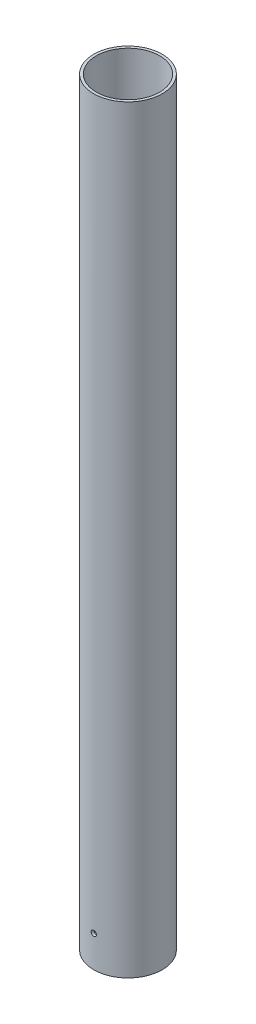
from build123d import *

# Parameters (mm, degrees)
SKETCH1_R               = 41.275
SKETCH1_R_2             = 38.1
BOSS_EXTRUDE1_DEPTH     = 914.4
CUT_EXTRUDE1_DEPTH      = 917.261213438
CUT_EXTRUDE1_DEPTH_BACK = 917.261213438
SKETCH2_R               = 3.175


with BuildPart() as part:
    # Sketch1 → Boss-Extrude1 (new body)
    with BuildSketch(Plane(origin=(0, 0, 0), x_dir=(1, 0, 0), z_dir=(0, 1, 0))):
        Circle(SKETCH1_R)
        Circle(SKETCH1_R_2, mode=Mode.SUBTRACT)
    extrude(amount=BOSS_EXTRUDE1_DEPTH)

    # Sketch2 → Cut-Extrude1 (cut, two sides: drawn at the far end of the back side and taken through both)
    with BuildSketch(Plane.XY.offset(-CUT_EXTRUDE1_DEPTH_BACK)):
        with Locations((0, 38.1)):
            Circle(SKETCH2_R)
    extrude(amount=CUT_EXTRUDE1_DEPTH + CUT_EXTRUDE1_DEPTH_BACK, mode=Mode.SUBTRACT)


solid = part.part
